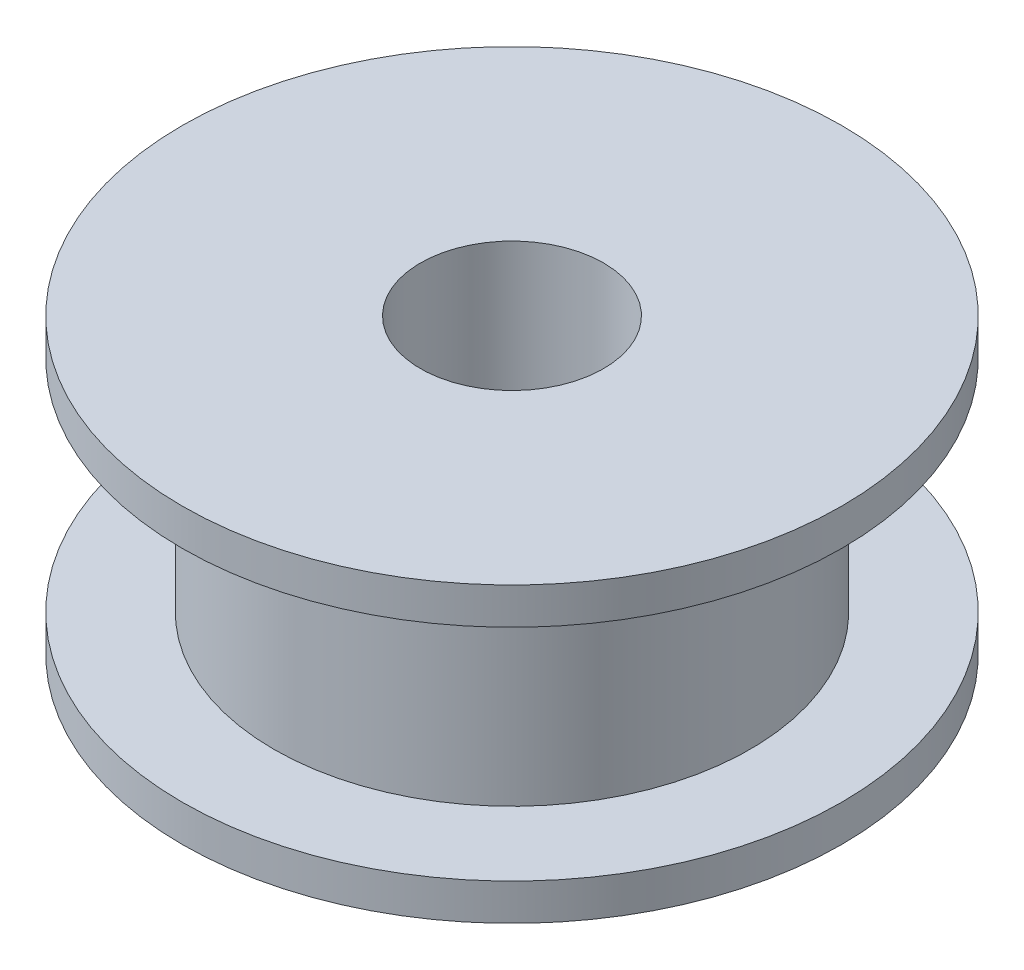
from build123d import *


with BuildPart() as part:
    # Sketch1 → Revolve1 (revolve)
    with BuildSketch(Plane.XY):
        Polygon((2.5, 0), (2.5, 8), (9, 8), (9, 7), (6.5, 7), (6.5, 1), (9, 1), (9, 0), align=None)
    revolve(axis=Axis((0, 0, 0), (0, 1, 0)))


solid = part.part
